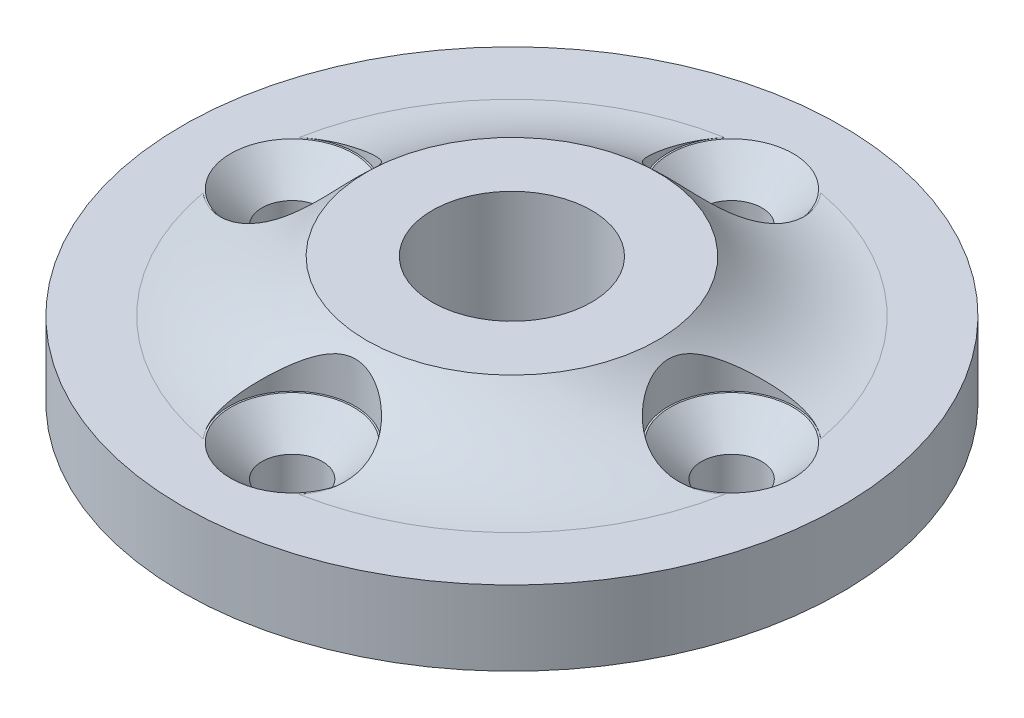
from build123d import *

# Parameters (mm, degrees)
SKETCH2_R           = 30
BOSS_EXTRUDE1_DEPTH = 6.8
SKETCH3_R           = 13.25
SKETCH3_R_2         = 7.25
BOSS_EXTRUDE2_DEPTH = 4.7
FILLET1_R           = 15
SKETCH6_R           = 5.75
CUT_EXTRUDE3_DEPTH  = 4.7
CIRPATTERN1_COUNT   = 4
SKETCH7_R           = 7.25
CUT_EXTRUDE4_DEPTH  = 44.957365708


with BuildPart() as part:
    # Sketch2 → Boss-Extrude1 (new body)
    with BuildSketch(Plane(origin=(0, 0, 0), x_dir=(1, 0, 0), z_dir=(0, 1, 0))):
        with Locations(Location((0, 0, 0), (0, 0, 270))):
            Circle(SKETCH2_R)
    extrude(amount=BOSS_EXTRUDE1_DEPTH)

    # Sketch3 → Boss-Extrude2 (add)
    with BuildSketch(Plane(origin=(0, 6.8, 0), x_dir=(1, 0, 0), z_dir=(0, 1, 0))):
        with Locations(Location((0, 0, 0), (0, 0, 270))):
            Circle(SKETCH3_R)
        with Locations(Location((0, 0, 0), (0, 0, 270))):
            Circle(SKETCH3_R_2, mode=Mode.SUBTRACT)
    extrude(amount=BOSS_EXTRUDE2_DEPTH)

    # Fillet1
    # the kernel refuses this fillet: 15 mm, written as the material it adds along each edge
    with BuildSketch(Plane(origin=(0, 6.8, 0), x_dir=(0, 0, 1), z_dir=(-1, 0, 0))) as fillet1_piece_1:
        with BuildLine():
            CenterArc((24.154586191, 15), FILLET1_R, 223.366822413, 46.633177587)
            Line((13.25, 4.7), (13.031908276, 4.494))
            ThreePointArc((13.031908276, 4.494), (12.95, 2.35), (12.95, 0))
            Line((12.95, 0), (13.25, -0.3))
            Line((13.25, -0.3), (24.154586191, -0.3))
            Line((24.154586191, -0.3), (24.154586191, 0))
        make_face()
    revolve(axis=Axis((0, 6.8, 0), (0, 1, 0)))

    # Sketch9 → CSK for M5 Hex Socket Countersunk Cap Screw1 (revolve, cut)
    with BuildSketch(Plane(origin=(0, 6.8, -20), x_dir=(0, 0, 1), z_dir=(1, 0, 0))):
        Polygon((0, 0), (0, 6.8), (2.75, 6.8), (2.75, 2.85), (5.6, 0), align=None)
    csk_for_m5_hex_socket_countersunk_cap_sc = revolve(axis=Axis((0, 13.15, -20), (0, -1, 0)), mode=Mode.SUBTRACT)

    # Sketch6 → Cut-Extrude3 (cut)
    with BuildSketch(Plane(origin=(0, 11.5, 0), x_dir=(1, 0, 0), z_dir=(0, 1, 0))):
        with Locations((0, 20)):
            Circle(SKETCH6_R)
    cut_extrude3 = extrude(amount=-CUT_EXTRUDE3_DEPTH, mode=Mode.SUBTRACT)

    # CirPattern1: CSK for M5 Hex Socket Countersunk Cap Screw1, Cut-Extrude3 ×4 about axis
    cirpattern1_axis = Axis((0, 0, 0), (0, 1, 0))
    add([csk_for_m5_hex_socket_countersunk_cap_sc.rotate(cirpattern1_axis, i * 360 / CIRPATTERN1_COUNT) for i in range(1, CIRPATTERN1_COUNT)], mode=Mode.SUBTRACT)
    add([cut_extrude3.rotate(cirpattern1_axis, i * 360 / CIRPATTERN1_COUNT) for i in range(1, CIRPATTERN1_COUNT)], mode=Mode.SUBTRACT)

    # Sketch7 → Cut-Extrude4 (cut, through all)
    with BuildSketch(Plane(origin=(0, 11.5, 0), x_dir=(1, 0, 0), z_dir=(0, 1, 0))):
        with Locations(Location((0, 0, 0), (0, 0, 270))):
            Circle(SKETCH7_R)
    extrude(amount=-CUT_EXTRUDE4_DEPTH, mode=Mode.SUBTRACT)


solid = part.part
